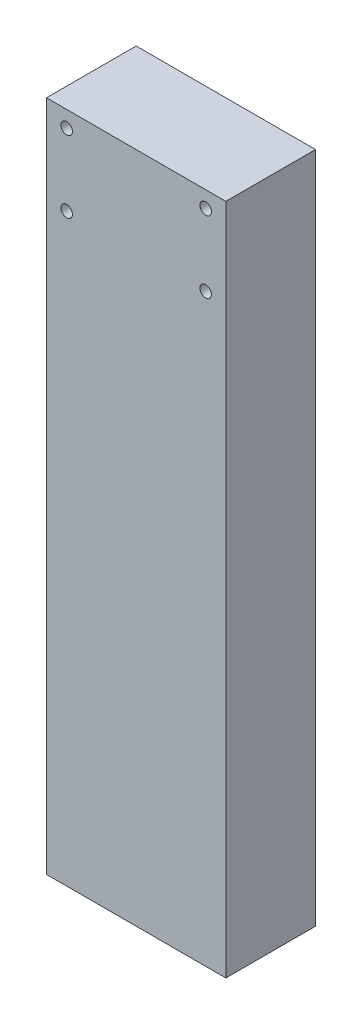
from build123d import *

# Parameters (mm, degrees)
SKETCH1_W               = 101.6
SKETCH1_H               = 50.8
BOSS_EXTRUDE1_DEPTH     = 381
F_1_4_CLEARANCE_HOLE2_D = 6.5278


with BuildPart() as part:
    # Sketch1 → Boss-Extrude1 (new body)
    with BuildSketch(Plane(origin=(0, 0, 0), x_dir=(1, 0, 0), z_dir=(0, 1, 0))):
        Rectangle(SKETCH1_W, SKETCH1_H)
    extrude(amount=BOSS_EXTRUDE1_DEPTH)

    # 1/4 Clearance Hole2 (through all)
    with Locations(Plane(origin=(0, 205.765448605, 25.4), x_dir=(1, 0, 0), z_dir=(0, 0, 1))):
        with Locations((39.37, 165.995301395), (39.37, 125.355301395), (-39.37, 125.355301395), (-39.37, 165.995301395)):
            Hole(F_1_4_CLEARANCE_HOLE2_D / 2)


solid = part.part
